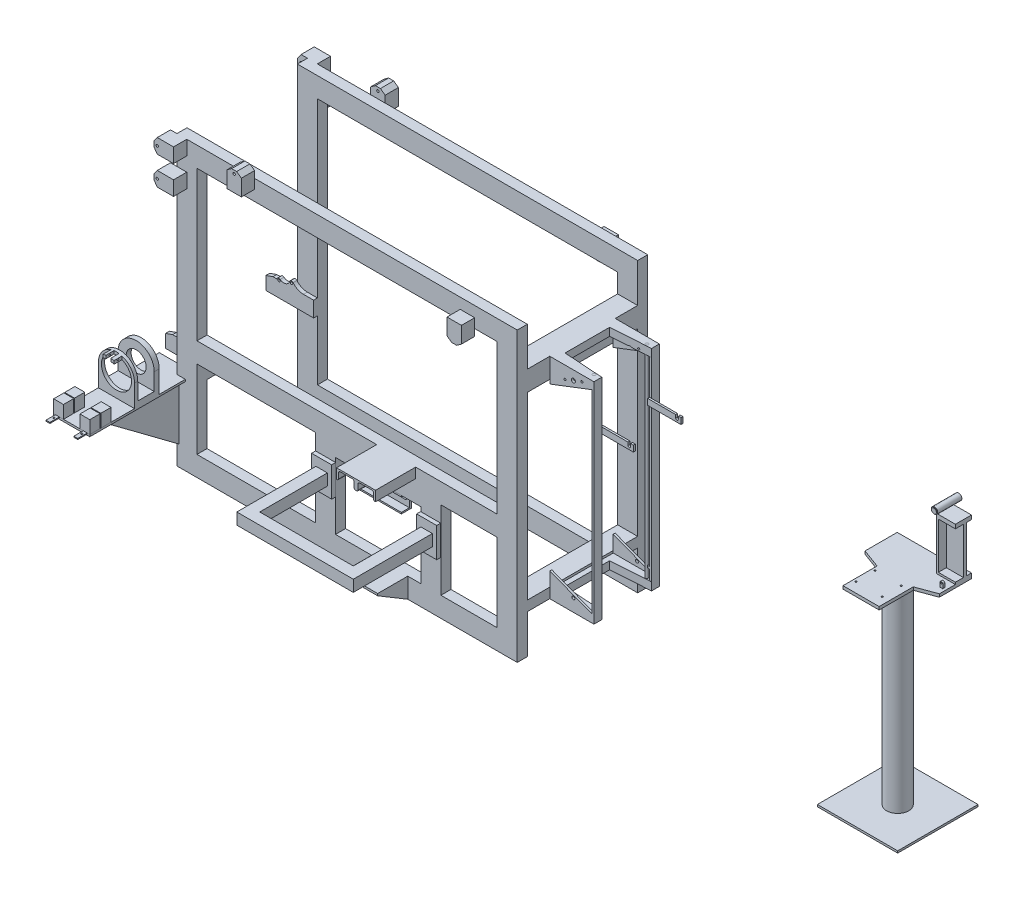
from build123d import *

# Parameters (mm, degrees)
ESQUISSE8_W                    = 1695
ESQUISSE8_H                    = 1434
ESQUISSE8_W_2                  = 1495.38
ESQUISSE8_H_2                  = 744.38
BOSS_EXTRU_8_DEPTH             = 50.13
ESQUISSE9_W                    = 1695
ESQUISSE9_H                    = 1434
ESQUISSE9_W_2                  = 1495.38
ESQUISSE9_H_2                  = 744.38
ESQUISSE9_W_3                  = 280.38
ESQUISSE9_H_3                  = 390.19
ESQUISSE9_W_4                  = 425.38
ESQUISSE9_W_5                  = 590
ESQUISSE9_H_4                  = 58.19
BOSS_EXTRU_9_DEPTH             = 50.13
ESQUISSE12_W                   = 1495.38
ESQUISSE12_H                   = 490
ENL_V_MAT_EXTRU_1_DEPTH        = 50.13
ESQUISSE13_W                   = 650
ESQUISSE13_H                   = 100
ESQUISSE13_H_2                 = 50
BOSS_EXTRU_10_DEPTH            = 99.81
ESQUISSE14_W                   = 39
ESQUISSE14_H                   = 1046
BOSS_EXTRU_11_DEPTH            = 9
BOSS_EXTRU_11_2_DEPTH          = 9
BOSS_EXTRU_12_START            = -162
ESQUISSE15_W                   = 220
ESQUISSE15_H                   = 39
BOSS_EXTRU_12_DEPTH            = 326
BOSS_EXTRU_13_DEPTH            = 10
ENL_V_MAT_EXTRU_2_REACH        = 2374.198
R_P_TITION_LIN_AIRE1_COUNT     = 2
R_P_TITION_LIN_AIRE1_PITCH     = 316
SYM_TRIE1_COPY_1_DEPTH         = 10
BOSS_EXTRU_14_DEPTH            = 66
ESQUISSE20_W                   = 580
ESQUISSE20_H                   = 57
BOSS_EXTRU_15_DEPTH            = 414
ESQUISSE21_W                   = 466
ESQUISSE21_H                   = 357
ENL_V_MAT_EXTRU_3_DEPTH        = 2461.517551857
ESQUISSE22_W                   = 100
ESQUISSE22_H                   = 148
BOSS_EXTRU_16_DEPTH            = 20
BOSS_EXTRU_17_START            = -50.13
ESQUISSE23_W                   = 180
ESQUISSE23_H                   = 10
BOSS_EXTRU_17_DEPTH            = 526.13
ESQUISSE24_W                   = 19.5
ESQUISSE24_H                   = 5
BOSS_EXTRU_18_DEPTH            = 47
BOSS_EXTRU_19_DEPTH            = 10
BOSS_EXTRU_20_DEPTH            = 549.74
ENL_V_MAT_EXTRU_4_REACH        = 2794.265
ESQUISSE27_W                   = 480.87
ESQUISSE27_H                   = 87
ENL_V_MAT_EXTRU_5_DEPTH        = 31
ESQUISSE29_W                   = 49
ESQUISSE29_H                   = 51
BOSS_EXTRU_21_DEPTH            = 64
BOSS_EXTRU_21_2_DEPTH          = 64
BOSS_EXTRU_21_3_DEPTH          = 64
BOSS_EXTRU_21_4_DEPTH          = 64
BOSS_EXTRU_22_DEPTH            = 19
BOSS_EXTRU_23_START            = 130
BOSS_EXTRU_23_DEPTH            = 123
ENL_V_START                    = 25
ESQUISSE33_W                   = 180
ESQUISSE33_H                   = 82
ENL_V_MAT_EXTRU_7_DEPTH        = 2472.330952287
ENL_V_START_2                  = 237
ENL_V_MAT_EXTRU_8_DEPTH        = 2290.876724857
ENL_V_MAT_EXTRU_9_DEPTH        = 2527.876724857
ENL_V_MAT_EXTRU_9_DEPTH_BACK   = 2527.876724857
ESQUISSE34_R                   = 6
ESQUISSE35_W                   = 400
ESQUISSE35_H                   = 400
BOSS_EXTRU_24_DEPTH            = 10
ESQUISSE36_R                   = 55
BOSS_EXTRU_25_DEPTH            = 990
BOSS_EXTRU_27_DEPTH            = 15
BOSS_EXTRU_28_DEPTH            = 200
BOSS_EXTRU_29_START            = -326
ESQUISSE41_W                   = 9
ESQUISSE41_H                   = 30
BOSS_EXTRU_29_DEPTH            = 326
ENL_V_START_3                  = 161
ENL_V_MAT_EXTRU_10_DEPTH       = 328
ENL_V_START_4                  = 201
ENL_V_MAT_EXTRU_10_2_OUTLINE_W = 9
ENL_V_MAT_EXTRU_10_2_OUTLINE_H = 30
ENL_V_MAT_EXTRU_10_2_DEPTH     = 248
ENL_V_START_5                  = 439
ENL_V_MAT_EXTRU_10_3_DEPTH     = 9.402481998
ENL_V_START_6                  = 201.597518002
ENL_V_MAT_EXTRU_10_4_DEPTH     = 9.402481998
ESQUISSE44_W                   = 85
ESQUISSE44_H                   = 20
ESQUISSE44_W_2                 = 10
ESQUISSE44_H_2                 = 10
BOSS_EXTRU_30_DEPTH            = 80
ESQUISSE45_W                   = 15
ESQUISSE45_H                   = 260
BOSS_EXTRU_31_DEPTH            = 85
BOSS_EXTRU_32_START            = -30
ESQUISSE47_R                   = 3
BOSS_EXTRU_32_DEPTH            = 10
ESQUISSE48_R                   = 4
ENL_V_MAT_EXTRU_11_DEPTH       = 20
BOSS_EXTRU_33_START            = -9
ESQUISSE49_R                   = 16
ESQUISSE49_R_2                 = 12.125
BOSS_EXTRU_33_DEPTH            = 120
BOSS_EXTRU_34_START            = -12
ESQUISSE49_3_R                 = 12.125
BOSS_EXTRU_34_DEPTH            = 126
ESQUISSE50_W                   = 15
ESQUISSE50_H                   = 40
BOSS_EXTRU_35_DEPTH            = 200
ENL_V_START_7                  = -40
ENL_V_MAT_EXTRU_12_DEPTH       = 40
ESQUISSE53_R                   = 4
ENL_V_MAT_EXTRU_13_DEPTH       = 70
ESQUISSE54_R                   = 4
ENL_V_MAT_EXTRU_14_DEPTH       = 10
ESQUISSE55_R                   = 7
BOSS_EXTRU_36_DEPTH            = 1046
BOSS_EXTRU_36_2_DEPTH          = 1046
ESQUISSE56_R                   = 5
ESQUISSE56_R_2                 = 10
ESQUISSE56_R_3                 = 7.5
ENL_V_MAT_EXTRU_16_DEPTH       = 3832.536895637
ESQUISSE57_W                   = 12
ESQUISSE57_H                   = 10
BOSS_EXTRU_37_DEPTH            = 39
ESQUISSE58_R                   = 6
BOSS_EXTRU_39_DEPTH            = 18.87
ESQUISSE58_4_R                 = 6
ENL_V_MAT_EXTRU_17_DEPTH       = 18.87
BOSS_EXTRU_40_START            = 480.87
BOSS_EXTRU_40_OUTLINE_R        = 6
BOSS_EXTRU_40_DEPTH            = 19
ENL_V_START_8                  = 499.87
ESQUISSE58_6_R                 = 6
ENL_V_MAT_EXTRU_18_DEPTH       = 19
ENL_V_START_9                  = -20
ENL_V_MAT_EXTRU_19_DEPTH       = 519.87
ESQUISSE60_W                   = 180
ESQUISSE60_H                   = 150
BOSS_EXTRU_41_DEPTH            = 10
BOSS_EXTRU_42_DEPTH            = 10
R_P_TITION_LIN_AIRE2_COUNT     = 2
R_P_TITION_LIN_AIRE2_PITCH     = 170
ESQUISSE62_W                   = 213
ESQUISSE62_H                   = 80
BOSS_EXTRU_43_DEPTH            = 50.13
ESQUISSE63_W                   = 213
ESQUISSE63_H                   = 66
ENL_V_MAT_EXTRU_20_DEPTH       = 40


with BuildPart() as part:
    # Esquisse8 → Boss.-Extru.8 (new body)
    with BuildSketch(Plane.XY):
        with Locations((847.5, 717)):
            Rectangle(ESQUISSE8_W, ESQUISSE8_H)
        with Locations((847.5, 962)):
            Rectangle(ESQUISSE8_W_2, ESQUISSE8_H_2, mode=Mode.SUBTRACT)
    extrude(amount=BOSS_EXTRU_8_DEPTH)

    # Esquisse12 → Enlèv. mat.-Extru.1 (cut)
    with BuildSketch(Plane.XY.offset(50.13)):
        with Locations((847.5, 344.81)):
            Rectangle(ESQUISSE12_W, ESQUISSE12_H)
    extrude(amount=-ENL_V_MAT_EXTRU_1_DEPTH, mode=Mode.SUBTRACT)



with BuildPart() as body_2:
    # Esquisse9 → Boss.-Extru.9 (new body)
    # profile 1 of 2: a face of its own
    with BuildSketch(Plane(origin=(0, 0, 650), x_dir=(-1, 0, 0), z_dir=(0, 0, -1))):
        with Locations((-847.5, 717)):
            Rectangle(ESQUISSE9_W, ESQUISSE9_H)
        with Locations((-847.5, 962)):
            Rectangle(ESQUISSE9_W_2, ESQUISSE9_H_2, mode=Mode.SUBTRACT)
        with Locations((-1455, 294.905)):
            Rectangle(ESQUISSE9_W_3, ESQUISSE9_H_3, mode=Mode.SUBTRACT)
        with Locations((-1002.31, 294.905)):
            Rectangle(ESQUISSE9_W_4, ESQUISSE9_H_3, mode=Mode.SUBTRACT)
        with Locations((-394.81, 294.905)):
            Rectangle(ESQUISSE9_W_5, ESQUISSE9_H_3, mode=Mode.SUBTRACT)
    # profile 2 of 2: a face of its own
    with BuildSketch(Plane(origin=(0, 0, 650), x_dir=(-1, 0, 0), z_dir=(0, 0, -1))):
        with Locations((-1002.31, 460.905)):
            Rectangle(ESQUISSE9_W_4, ESQUISSE9_H_4)
    extrude(amount=BOSS_EXTRU_9_DEPTH)


with BuildPart() as part_1:
    add(part.part)

    add(body_2.part)  # Boss.-Extru.10 merges body 2
    # Esquisse13 → Boss.-Extru.10 (add)
    with BuildSketch(Plane(origin=(1695, 0, 0), x_dir=(0, 0, -1), z_dir=(1, 0, 0))):
        with Locations((-325, 1190)):
            Rectangle(ESQUISSE13_W, ESQUISSE13_H)
        with Locations((-325, 219)):
            Rectangle(ESQUISSE13_W, ESQUISSE13_H_2)
    extrude(amount=-BOSS_EXTRU_10_DEPTH)



with BuildPart() as body_2_2:
    # Esquisse14 → Boss.-Extru.11 (new body)
    with BuildSketch(Plane(origin=(1915, 0, 0), x_dir=(0, 0, -1), z_dir=(1, 0, 0))):
        with Locations((-181.5, 717)):
            Rectangle(ESQUISSE14_W, ESQUISSE14_H)
    extrude(amount=-BOSS_EXTRU_11_DEPTH)


with BuildPart() as body_3:
    # Esquisse14 → Boss.-Extru.11 2 (new body)
    with BuildSketch(Plane(origin=(1915, 0, 0), x_dir=(0, 0, -1), z_dir=(1, 0, 0))):
        with Locations((-468.5, 717)):
            Rectangle(ESQUISSE14_W, ESQUISSE14_H)
    extrude(amount=-BOSS_EXTRU_11_2_DEPTH)


with BuildPart() as part_2:
    add(part_1.part)

    add(body_2_2.part)  # Boss.-Extru.12 merges body 2 2

    add(body_3.part)  # Boss.-Extru.12 merges body 3
    # Esquisse15 → Boss.-Extru.12 (add)
    with BuildSketch(Plane(origin=(0, 0, 0), x_dir=(-1, 0, 0), z_dir=(0, 0, -1)).offset(BOSS_EXTRU_12_START)):
        with Locations((-1805, 1220.5)):
            Rectangle(ESQUISSE15_W, ESQUISSE15_H)
    boss_extru_12 = extrude(amount=-BOSS_EXTRU_12_DEPTH)

    # Esquisse16 → Boss.-Extru.13 (add)
    with BuildSketch(Plane(origin=(0, 0, 162), x_dir=(-1, 0, 0), z_dir=(0, 0, -1))):
        Polygon((-1906, 1201), (-1695, 1120), (-1695, 1201), align=None)
    boss_extru_13 = extrude(amount=-BOSS_EXTRU_13_DEPTH)

    # Esquisse18 → Enlèv. mat.-Extru.2 (cut, up to next)
    with BuildSketch(Plane(origin=(0, 1240, 0), x_dir=(1, 0, 0), z_dir=(0, 1, 0)), mode=Mode.PRIVATE) as enl_v_mat_extru_2_sk1:
        Polygon((1915, -201), (1719.19, -214), (1719.19, -436), (1915, -449), align=None)
    enl_v_mat_extru_2_tool1 = extrude(enl_v_mat_extru_2_sk1.sketch, amount=-ENL_V_MAT_EXTRU_2_REACH, mode=Mode.PRIVATE) & part_2.part
    enl_v_mat_extru_2 = enl_v_mat_extru_2_tool1.solids().sort_by_distance((1818.90034, 1240, 325))[0]
    add(enl_v_mat_extru_2, mode=Mode.SUBTRACT)

    # Répétition linéaire1: Boss.-Extru.13 ×2
    with Locations(*[(0, 0, i * R_P_TITION_LIN_AIRE1_PITCH) for i in range(1, R_P_TITION_LIN_AIRE1_COUNT)]):
        add(boss_extru_13)

    # Symétrie1: Boss.-Extru.12, Boss.-Extru.13, Enlèv. mat.-Extru.2 across plane
    add(boss_extru_12.mirror(Plane.ZX.offset(717)))
    add(boss_extru_13.mirror(Plane.ZX.offset(717)))
    add(enl_v_mat_extru_2.mirror(Plane.ZX.offset(717)), mode=Mode.SUBTRACT)

    # Symétrie1 copy 1 sketch → Symétrie1 copy 1 (add)
    with BuildSketch(Plane(origin=(0, 1434, 478), x_dir=(-1, 0, 0), z_dir=(0, 0, -1))):
        Polygon((-1906, -1201), (-1695, -1120), (-1695, -1201), align=None)
    extrude(amount=-SYM_TRIE1_COPY_1_DEPTH)

    # Esquisse19 → Boss.-Extru.14 (add)
    with BuildSketch(Plane.XY.offset(650)):
        Polygon((49, 1434), (-32, 1434), (-49, 1410.5), (-49, 1385.5), (-32, 1362), (49, 1362), align=None)
        Polygon((49, 1292), (-32, 1292), (-49, 1268.5), (-49, 1243.5), (-32, 1220), (49, 1220), align=None)
        Polygon((315, 1387), (387, 1387), (387, 1468), (363.5, 1484.99999415), (338.5, 1484.99999415), (315, 1468), align=None)
        Polygon((1411, 1381.19), (1483, 1381.19), (1483.000013162, 1300.19), (1459.500006581, 1283.19), (1434.500006581, 1283.19), (1411, 1300.19), align=None)
    boss_extru_14 = extrude(amount=BOSS_EXTRU_14_DEPTH)

    # Symétrie2: Boss.-Extru.14 across plane
    add(boss_extru_14.mirror(Plane(origin=(0, 0, 325), x_dir=(1, 0, 0), z_dir=(0, 0, -1))))

    # Esquisse20 → Boss.-Extru.15 (add)
    with BuildSketch(Plane.XY.offset(650)):
        with Locations((1002.31, 336.31)):
            Rectangle(ESQUISSE20_W, ESQUISSE20_H)
    extrude(amount=BOSS_EXTRU_15_DEPTH)

    # Esquisse21 → Enlèv. mat.-Extru.3 (cut, through all)
    with BuildSketch(Plane(origin=(0, 364.81, 0), x_dir=(1, 0, 0), z_dir=(0, 1, 0))):
        with Locations((1002.31, -828.5)):
            Rectangle(ESQUISSE21_W, ESQUISSE21_H)
    extrude(amount=-ENL_V_MAT_EXTRU_3_DEPTH, mode=Mode.SUBTRACT)

    # Esquisse22 → Boss.-Extru.16 (add)
    with BuildSketch(Plane.XY.offset(650)):
        with Locations((1263.81, 336.31)):
            Rectangle(ESQUISSE22_W, ESQUISSE22_H)
        with Locations((740.81, 336.31)):
            Rectangle(ESQUISSE22_W, ESQUISSE22_H)
    extrude(amount=BOSS_EXTRU_16_DEPTH)

    # Esquisse23 → Boss.-Extru.17 (add)
    with BuildSketch(Plane.XY.offset(650).offset(BOSS_EXTRU_17_START)):
        with Locations((-48.19, 389.81)):
            Rectangle(ESQUISSE23_W, ESQUISSE23_H)
    extrude(amount=BOSS_EXTRU_17_DEPTH)

    # Esquisse24 → Boss.-Extru.18 (add)
    with BuildSketch(Plane.XY.offset(1126)):
        with Locations((19.06, 392.31)):
            Rectangle(ESQUISSE24_W, ESQUISSE24_H)
        with Locations((-119.44, 392.31)):
            Rectangle(ESQUISSE24_W, ESQUISSE24_H)
    extrude(amount=BOSS_EXTRU_18_DEPTH)

    # Esquisse25 → Boss.-Extru.19 (add)
    with BuildSketch(Plane.ZY):
        Polygon((650, 99.81), (1032, 384.81), (650, 384.81), align=None)
    extrude(amount=-BOSS_EXTRU_19_DEPTH)

    # Esquisse26 → Boss.-Extru.20 (add)
    with BuildSketch(Plane(origin=(0, 0, 50.13), x_dir=(-1, 0, 0), z_dir=(0, 0, -1))):
        Polygon((104.248874503, 484.81), (138.19, 472.81), (138.19, 397.81), (-99.81, 397.81), (-99.81, 484.81), align=None)
    extrude(amount=-BOSS_EXTRU_20_DEPTH)

    # Esquisse27 → Enlèv. mat.-Extru.4 (cut, up to next)
    with BuildSketch(Plane.ZY.offset(138.19), mode=Mode.PRIVATE) as enl_v_mat_extru_4_sk1:
        with Locations((309.565, 441.31)):
            Rectangle(ESQUISSE27_W, ESQUISSE27_H)
    enl_v_mat_extru_4_tool1 = extrude(enl_v_mat_extru_4_sk1.sketch, amount=-ENL_V_MAT_EXTRU_4_REACH, mode=Mode.PRIVATE) & part_2.part
    add(enl_v_mat_extru_4_tool1.solids().sort_by_distance((-138.19, 441.31, 309.565))[0], mode=Mode.SUBTRACT)

    # Esquisse28 → Enlèv. mat.-Extru.5 (cut)
    with BuildSketch(Plane.XY.offset(599.87)):
        Polygon((0, 397.81), (0, 484.81), (-104.248874503, 484.81), (-138.19, 472.81), (-138.19, 397.81), align=None)
    extrude(amount=-ENL_V_MAT_EXTRU_5_DEPTH, mode=Mode.SUBTRACT)

    # Esquisse30 → Boss.-Extru.22 (add)
    with BuildSketch(Plane(origin=(0, 0, 599.87), x_dir=(-1, 0, 0), z_dir=(0, 0, -1))):
        Polygon((0, 384.81), (138.19, 384.81), (0, 99.81), align=None)
    extrude(amount=-BOSS_EXTRU_22_DEPTH)

    # Esquisse32 → Boss.-Extru.23 (add)
    with BuildSketch(Plane.XY.offset(650).offset(BOSS_EXTRU_23_START)):
        with BuildLine():
            Line((0, 491.478687236), (0, 447.340669919))
            ThreePointArc((0, 447.340669919), (19.77782327, 473.102351081), (26.81, 504.81))
            Line((26.81, 504.81), (1.81, 504.81))
            ThreePointArc((1.81, 504.81), (1.355433695, 498.083187976), (0, 491.478687236))
        make_face()
        with BuildLine():
            ThreePointArc((-123.19, 504.81), (-79.897648919, 436.84217673), (0, 447.340669919))
            Line((0, 447.340669919), (0, 491.478687236))
            ThreePointArc((0, 491.478687236), (-54.916812024, 455.264566305), (-98.19, 504.81))
            Line((-98.19, 504.81), (-123.19, 504.81))
        make_face()
        with BuildLine():
            ThreePointArc((0, 562.279330081), (-79.897648919, 572.77782327), (-123.19, 504.81))
            Line((-123.19, 504.81), (-98.19, 504.81))
            ThreePointArc((-98.19, 504.81), (-54.916812024, 554.355433695), (0, 518.141312764))
            Line((0, 518.141312764), (0, 562.279330081))
        make_face()
        with BuildLine():
            Line((1.81, 504.81), (26.81, 504.81))
            ThreePointArc((26.81, 504.81), (19.77782327, 536.517648919), (0, 562.279330081))
            Line((0, 562.279330081), (0, 518.141312764))
            ThreePointArc((0, 518.141312764), (1.355433695, 511.536812024), (1.81, 504.81))
        make_face()
        with BuildLine():
            ThreePointArc((0, 580.821340601), (-91.565684433, 583.667783382), (-138.19, 504.81))
            Line((-138.19, 504.81), (-123.19, 504.81))
            ThreePointArc((-123.19, 504.81), (-79.897648919, 572.77782327), (0, 562.279330081))
            Line((0, 562.279330081), (0, 580.821340601))
        make_face()
        with BuildLine():
            ThreePointArc((41.81, 504.81), (30.667783382, 548.185684433), (0, 580.821340601))
            Line((0, 580.821340601), (0, 562.279330081))
            ThreePointArc((0, 562.279330081), (19.77782327, 536.517648919), (26.81, 504.81))
            Line((26.81, 504.81), (41.81, 504.81))
        make_face()
        with BuildLine():
            Line((0, 447.340669919), (0, 394.81))
            Line((0, 394.81), (41.81, 394.81))
            Line((41.81, 394.81), (41.81, 504.81))
            Line((41.81, 504.81), (26.81, 504.81))
            ThreePointArc((26.81, 504.81), (19.77782327, 473.102351081), (0, 447.340669919))
        make_face()
        with BuildLine():
            Line((-138.19, 504.81), (-138.19, 394.81))
            Line((-138.19, 394.81), (0, 394.81))
            Line((0, 394.81), (0, 447.340669919))
            ThreePointArc((0, 447.340669919), (-79.897648919, 436.84217673), (-123.19, 504.81))
            Line((-123.19, 504.81), (-138.19, 504.81))
        make_face()
    extrude(amount=BOSS_EXTRU_23_DEPTH)

    # Esquisse33 → Enlèv. mat.-Extru.7 (cut, through all)
    with BuildSketch(Plane(origin=(0, 394.81, 0), x_dir=(1, 0, 0), z_dir=(0, 1, 0)).offset(ENL_V_START)):
        with Locations((-48.19, -846)):
            Rectangle(ESQUISSE33_W, ESQUISSE33_H)
    extrude(amount=ENL_V_MAT_EXTRU_7_DEPTH, mode=Mode.SUBTRACT)

    # Esquisse32<3> → Enlèv. mat.-Extru.8 (cut, through all)
    with BuildSketch(Plane.XY.offset(650).offset(ENL_V_START_2)):
        with BuildLine():
            Line((0, 491.478687236), (0, 447.340669919))
            ThreePointArc((0, 447.340669919), (19.77782327, 473.102351081), (26.81, 504.81))
            Line((26.81, 504.81), (1.81, 504.81))
            ThreePointArc((1.81, 504.81), (1.355433695, 498.083187976), (0, 491.478687236))
        make_face()
        with BuildLine():
            ThreePointArc((-123.19, 504.81), (-79.897648919, 436.84217673), (0, 447.340669919))
            Line((0, 447.340669919), (0, 491.478687236))
            ThreePointArc((0, 491.478687236), (-54.916812024, 455.264566305), (-98.19, 504.81))
            Line((-98.19, 504.81), (-123.19, 504.81))
        make_face()
        with BuildLine():
            ThreePointArc((0, 562.279330081), (-79.897648919, 572.77782327), (-123.19, 504.81))
            Line((-123.19, 504.81), (-98.19, 504.81))
            ThreePointArc((-98.19, 504.81), (-54.916812024, 554.355433695), (0, 518.141312764))
            Line((0, 518.141312764), (0, 562.279330081))
        make_face()
        with BuildLine():
            Line((1.81, 504.81), (26.81, 504.81))
            ThreePointArc((26.81, 504.81), (19.77782327, 536.517648919), (0, 562.279330081))
            Line((0, 562.279330081), (0, 518.141312764))
            ThreePointArc((0, 518.141312764), (1.355433695, 511.536812024), (1.81, 504.81))
        make_face()
    extrude(amount=ENL_V_MAT_EXTRU_8_DEPTH, mode=Mode.SUBTRACT)

    # Esquisse34 → Enlèv. mat.-Extru.9 (cut, two sides: drawn at the far end of the back side and taken through both)
    with BuildSketch(Plane.XY.offset(650).offset(-ENL_V_MAT_EXTRU_9_DEPTH_BACK)):
        with Locations((-32, 1398)):
            Circle(ESQUISSE34_R)
        with Locations((-32, 1256)):
            Circle(ESQUISSE34_R)
        with Locations((351, 1468)):
            Circle(ESQUISSE34_R)
    extrude(amount=ENL_V_MAT_EXTRU_9_DEPTH + ENL_V_MAT_EXTRU_9_DEPTH_BACK, mode=Mode.SUBTRACT)

    # Esquisse40 → Boss.-Extru.28 (add)
    with BuildSketch(Plane.XY.offset(650)):
        with BuildLine():
            Line((995, 589.81), (1189, 589.81))
            Line((1189, 589.81), (1189, 539.81))
            Line((1189, 539.81), (1187, 539.81))
            ThreePointArc((1187, 539.81), (1181.343145751, 542.153145751), (1179, 547.81))
            Line((1179, 547.81), (1179, 573.81))
            ThreePointArc((1179, 573.81), (1176.656854249, 579.466854249), (1171, 581.81))
            Line((1171, 581.81), (1110, 581.81))
            ThreePointArc((1110, 581.81), (1104.343145751, 579.466854249), (1102, 573.81))
            Line((1102, 573.81), (1102, 547.81))
            ThreePointArc((1102, 547.81), (1099.656854249, 542.153145751), (1094, 539.81))
            Line((1094, 539.81), (1090, 539.81))
            ThreePointArc((1090, 539.81), (1084.343145751, 542.153145751), (1082, 547.81))
            Line((1082, 547.81), (1082, 573.81))
            ThreePointArc((1082, 573.81), (1079.656854249, 579.466854249), (1074, 581.81))
            Line((1074, 581.81), (1013, 581.81))
            ThreePointArc((1013, 581.81), (1007.343145751, 579.466854249), (1005, 573.81))
            Line((1005, 573.81), (1005, 547.81))
            ThreePointArc((1005, 547.81), (1002.656854249, 542.153145751), (997, 539.81))
            Line((997, 539.81), (995, 539.81))
            Line((995, 539.81), (995, 589.81))
        make_face()
    extrude(amount=BOSS_EXTRU_28_DEPTH)

    # Esquisse41 → Boss.-Extru.29 (add)
    with BuildSketch(Plane.XY.offset(488).offset(BOSS_EXTRU_29_START)):
        with BuildLine():
            Line((1915, 1025), (1915, 995))
            Line((1915, 995), (2072, 995))
            Line((2072, 995), (2072, 1025))
            Line((2072, 1025), (2058, 1025))
            Line((2058, 1025), (2058, 1010.5))
            ThreePointArc((2058, 1010.5), (2051.5, 1004), (2045, 1010.5))
            Line((2045, 1010.5), (2045, 1025))
            Line((2045, 1025), (1915, 1025))
        make_face()
        with Locations((1910.5, 1010)):
            Rectangle(ESQUISSE41_W, ESQUISSE41_H)
    extrude(amount=BOSS_EXTRU_29_DEPTH)

    # Enlèv. mat.-Extru.10: read off the stored shape, not the designer's step
    # Enlèv. mat.-Extru.10 outline → Enlèv. mat.-Extru.10 (cut)
    with BuildSketch(Plane.XY.offset(ENL_V_START_3)):
        with BuildLine():
            Line((1915, 1025), (1915, 995))
            Line((1915, 995), (2072, 995))
            Line((2072, 995), (2072, 1025))
            Line((2072, 1025), (2058, 1025))
            Line((2058, 1025), (2058, 1010.5))
            ThreePointArc((2058, 1010.5), (2051.5, 1004), (2045, 1010.5))
            Line((2045, 1010.5), (2045, 1025))
            Line((2045, 1025), (1915, 1025))
        make_face()
    extrude(amount=ENL_V_MAT_EXTRU_10_DEPTH, mode=Mode.SUBTRACT)

    # Enl_v. mat.-Extru.10 2 outline → Enl_v. mat.-Extru.10 2 (cut)
    with BuildSketch(Plane.XY.offset(ENL_V_START_4)):
        with Locations((1910.5, 1010)):
            Rectangle(ENL_V_MAT_EXTRU_10_2_OUTLINE_W, ENL_V_MAT_EXTRU_10_2_OUTLINE_H)
    extrude(amount=ENL_V_MAT_EXTRU_10_2_DEPTH, mode=Mode.SUBTRACT)

    # Esquisse50 → Boss.-Extru.35 (add)
    with BuildSketch(Plane(origin=(0, 394.81, 0), x_dir=(1, 0, 0), z_dir=(0, 1, 0))):
        with Locations((-28.19, -923)):
            Rectangle(ESQUISSE50_W, ESQUISSE50_H)
        with Locations((-68.19, -923)):
            Rectangle(ESQUISSE50_W, ESQUISSE50_H)
    extrude(amount=BOSS_EXTRU_35_DEPTH)

    # Enlèv. mat.-Extru.12: read off the stored shape, not the designer's step
    # Enlèv. mat.-Extru.12 outline → Enlèv. mat.-Extru.12 (cut)
    with BuildSketch(Plane.XY.offset(943).offset(ENL_V_START_7)):
        with BuildLine():
            Line((-75.69, 594.81), (-75.69, 590.505682505))
            ThreePointArc((-75.69, 590.505682505), (-68.263482901, 592.542863194), (-60.69, 593.93771735))
            Line((-60.69, 593.93771735), (-60.69, 594.81))
            Line((-60.69, 594.81), (-75.69, 594.81))
        make_face()
        with BuildLine():
            ThreePointArc((-60.69, 578.760997289), (-68.298623915, 577.06401888), (-75.69, 574.586428685))
            Line((-75.69, 574.586428685), (-75.69, 394.81))
            Line((-75.69, 394.81), (-60.69, 394.81))
            Line((-60.69, 394.81), (-60.69, 578.760997289))
        make_face()
        with BuildLine():
            Line((-35.69, 594.81), (-35.69, 593.93771735))
            ThreePointArc((-35.69, 593.93771735), (-28.116517099, 592.542863194), (-20.69, 590.505682505))
            Line((-20.69, 590.505682505), (-20.69, 594.81))
            Line((-20.69, 594.81), (-35.69, 594.81))
        make_face()
        with BuildLine():
            ThreePointArc((-20.69, 574.586428685), (-28.081376085, 577.06401888), (-35.69, 578.760997289))
            Line((-35.69, 578.760997289), (-35.69, 394.81))
            Line((-35.69, 394.81), (-20.69, 394.81))
            Line((-20.69, 394.81), (-20.69, 574.586428685))
        make_face()
    extrude(amount=ENL_V_MAT_EXTRU_12_DEPTH, mode=Mode.SUBTRACT)

    # Esquisse53 → Enlèv. mat.-Extru.13 (cut)
    with BuildSketch(Plane.ZY.offset(75.69)):
        with Locations((923, 584.586428685)):
            Circle(ESQUISSE53_R)
    extrude(amount=-ENL_V_MAT_EXTRU_13_DEPTH, mode=Mode.SUBTRACT)

    # Esquisse54 → Enlèv. mat.-Extru.14 (cut)
    with BuildSketch(Plane(origin=(0, 394.81, 0), x_dir=(1, 0, 0), z_dir=(0, 1, 0))):
        with Locations(Location((19.06, -1143, 0), (0, 0, 270))):
            Circle(ESQUISSE54_R)
        with Locations(Location((-119.44, -1143, 0), (0, 0, 270))):
            Circle(ESQUISSE54_R)
    extrude(amount=-ENL_V_MAT_EXTRU_14_DEPTH, mode=Mode.SUBTRACT)

    # Esquisse56 → Enlèv. mat.-Extru.16 (cut, through all)
    with BuildSketch(Plane.XY.offset(488)):
        with Locations(Location((1855, 1210, 0), (0, 0, 90))):
            Circle(ESQUISSE56_R)
        with Locations((1770.978386276, 1177.745257291)):
            Circle(ESQUISSE56_R)
        with Locations((1812.989193138, 1193.872628645)):
            Circle(ESQUISSE56_R_2)
        with Locations((1812.989193138, 256.5)):
            Circle(ESQUISSE56_R_3)
    extrude(amount=-ENL_V_MAT_EXTRU_16_DEPTH, mode=Mode.SUBTRACT)

    # Esquisse57 → Boss.-Extru.37 (add)
    with BuildSketch(Plane(origin=(0, 0, 162), x_dir=(-1, 0, 0), z_dir=(0, 0, -1))):
        with Locations((-1900, 289)):
            Rectangle(ESQUISSE57_W, ESQUISSE57_H)
    extrude(amount=-BOSS_EXTRU_37_DEPTH)

    # Esquisse58 → Boss.-Extru.39 (add)
    # profile 1 of 9: a face of its own
    with BuildSketch(Plane(origin=(0, 0, 550), x_dir=(-1, 0, 0), z_dir=(0, 0, -1))):
        with BuildLine():
            ThreePointArc((60.571284677, 489.103192885), (58.391116004, 487.10638466), (56.529128885, 484.81))
            Line((56.529128885, 484.81), (89.376011624, 484.81))
            ThreePointArc((89.376011624, 484.81), (75.900897263, 493.177877017), (60.571284677, 489.103192885))
        make_face()
    # profile 2 of 9: a face of its own
    with BuildSketch(Plane(origin=(0, 0, 550), x_dir=(-1, 0, 0), z_dir=(0, 0, -1))):
        with BuildLine():
            ThreePointArc((60.571284677, 489.103192885), (54.742246092, 485.913755105), (48.19, 484.81))
            Line((48.19, 484.81), (56.529128885, 484.81))
            ThreePointArc((56.529128885, 484.81), (58.391116004, 487.10638466), (60.571284677, 489.103192885))
        make_face()
    # profile 3 of 9: a face of its own
    with BuildSketch(Plane(origin=(0, 0, 550), x_dir=(-1, 0, 0), z_dir=(0, 0, -1))):
        with BuildLine():
            ThreePointArc((29.952570255, 493.066960935), (29.501482848, 488.843216573), (28.168568611, 484.81))
            Line((28.168568611, 484.81), (48.19, 484.81))
            ThreePointArc((48.19, 484.81), (36.303671523, 488.725373945), (29.071285127, 498.938480467))
            ThreePointArc((29.071285127, 498.938480467), (29.731021881, 496.035605621), (29.952570255, 493.066960935))
        make_face()
    # profile 4 of 9: a face of its own
    with BuildSketch(Plane(origin=(0, 0, 550), x_dir=(-1, 0, 0), z_dir=(0, 0, -1))):
        with BuildLine():
            ThreePointArc((-1.599488823, 509.393317879), (-1.172472441, 496.850960203), (2.36424305, 484.81))
            Line((2.36424305, 484.81), (28.168568611, 484.81))
            ThreePointArc((28.168568611, 484.81), (29.501482848, 488.843216573), (29.952570255, 493.066960935))
            ThreePointArc((29.952570255, 493.066960935), (29.731021881, 496.035605621), (29.071285127, 498.938480467))
            ThreePointArc((29.071285127, 498.938480467), (16.405435999, 511.997373601), (-1.599488823, 509.393317879))
        make_face()
        with Locations((9.952570255, 493.066960935)):
            Circle(ESQUISSE58_R, mode=Mode.SUBTRACT)
    # profile 5 of 9: a face of its own
    with BuildSketch(Plane(origin=(0, 0, 550), x_dir=(-1, 0, 0), z_dir=(0, 0, -1))):
        with BuildLine():
            ThreePointArc((-5.560545458, 505.690084197), (-8.864610758, 499.842925717), (-10.046751476, 493.231673708))
            ThreePointArc((-10.046751476, 493.231673708), (-9.613569358, 488.923751956), (-8.263428102, 484.81))
            Line((-8.263428102, 484.81), (2.36424305, 484.81))
            ThreePointArc((2.36424305, 484.81), (-1.172472441, 496.850960203), (-1.599488823, 509.393317879))
            ThreePointArc((-1.599488823, 509.393317879), (-3.706104883, 507.67656714), (-5.560545458, 505.690084197))
        make_face()
    # profile 6 of 9: a face of its own
    with BuildSketch(Plane(origin=(0, 0, 550), x_dir=(-1, 0, 0), z_dir=(0, 0, -1))):
        with BuildLine():
            Line((2.36424305, 484.81), (-8.263428102, 484.81))
            ThreePointArc((-8.263428102, 484.81), (-1.050329395, 476.365577779), (9.555432537, 473.070904283))
            ThreePointArc((9.555432537, 473.070904283), (5.553886293, 478.691772496), (2.36424305, 484.81))
        make_face()
    # profile 7 of 9: a face of its own
    with BuildSketch(Plane(origin=(0, 0, 550), x_dir=(-1, 0, 0), z_dir=(0, 0, -1))):
        with BuildLine():
            ThreePointArc((2.36424305, 484.81), (5.553886293, 478.691772496), (9.555432537, 473.070904283))
            ThreePointArc((9.555432537, 473.070904283), (20.621663032, 476.150387425), (28.168568611, 484.81))
            Line((28.168568611, 484.81), (2.36424305, 484.81))
        make_face()
    # profile 8 of 9: a face of its own
    with BuildSketch(Plane(origin=(0, 0, 550), x_dir=(-1, 0, 0), z_dir=(0, 0, -1))):
        with BuildLine():
            ThreePointArc((-10.046751476, 493.231673708), (-10.554606265, 488.915012088), (-11.983017895, 484.81))
            Line((-11.983017895, 484.81), (-8.263428102, 484.81))
            ThreePointArc((-8.263428102, 484.81), (-9.613569358, 488.923751956), (-10.046751476, 493.231673708))
        make_face()
    # profile 9 of 9: a face of its own
    with BuildSketch(Plane(origin=(0, 0, 550), x_dir=(-1, 0, 0), z_dir=(0, 0, -1))):
        with BuildLine():
            Line((-49.470071636, 484.81), (-11.983017895, 484.81))
            ThreePointArc((-11.983017895, 484.81), (-10.554606265, 488.915012088), (-10.046751476, 493.231673708))
            ThreePointArc((-10.046751476, 493.231673708), (-8.864610758, 499.842925717), (-5.560545458, 505.690084197))
            ThreePointArc((-5.560545458, 505.690084197), (-25.159454586, 490.295826868), (-49.470071636, 484.81))
        make_face()
    extrude(amount=-BOSS_EXTRU_39_DEPTH)

    # Esquisse58<4> → Enlèv. mat.-Extru.17 (cut)
    with BuildSketch(Plane(origin=(0, 0, 550), x_dir=(-1, 0, 0), z_dir=(0, 0, -1))):
        with Locations((72.952570255, 473.39638648)):
            Circle(ESQUISSE58_4_R)
    extrude(amount=-ENL_V_MAT_EXTRU_17_DEPTH, mode=Mode.SUBTRACT)

    # Boss.-Extru.40: read off the stored shape, not the designer's step
    # Boss.-Extru.40 outline → Boss.-Extru.40 (add)
    # profile 1 of 2: a face of its own
    with BuildSketch(Plane(origin=(0, 0, 550), x_dir=(-1, 0, 0), z_dir=(0, 0, -1)).offset(BOSS_EXTRU_40_START)):
        with BuildLine():
            Line((-49.470071636, 484.81), (48.19, 484.81))
            ThreePointArc((48.19, 484.81), (36.303671523, 488.725373945), (29.071285127, 498.938480467))
            ThreePointArc((29.071285127, 498.938480467), (13.779595804, 512.697393315), (-5.560545458, 505.690084197))
            ThreePointArc((-5.560545458, 505.690084197), (-25.159454587, 490.295826868), (-49.470071636, 484.81))
        make_face()
        with Locations((9.952570255, 493.066960935)):
            Circle(BOSS_EXTRU_40_OUTLINE_R, mode=Mode.SUBTRACT)
    # profile 2 of 2: a face of its own
    with BuildSketch(Plane(origin=(0, 0, 550), x_dir=(-1, 0, 0), z_dir=(0, 0, -1)).offset(BOSS_EXTRU_40_START)):
        with BuildLine():
            ThreePointArc((89.376011624, 484.81), (75.900897546, 493.177876975), (60.571285127, 489.10319324))
            ThreePointArc((60.571285127, 489.10319324), (54.742246363, 485.913755199), (48.19, 484.81))
            Line((48.19, 484.81), (89.376011624, 484.81))
        make_face()
    extrude(amount=BOSS_EXTRU_40_DEPTH)

    # Esquisse58<6> → Enlèv. mat.-Extru.18 (cut)
    with BuildSketch(Plane(origin=(0, 0, 550), x_dir=(-1, 0, 0), z_dir=(0, 0, -1)).offset(ENL_V_START_8)):
        with Locations((72.952570255, 473.39638648)):
            Circle(ESQUISSE58_6_R)
    extrude(amount=-ENL_V_MAT_EXTRU_18_DEPTH, mode=Mode.SUBTRACT)

    # Esquisse59 → Enlèv. mat.-Extru.19 (cut)
    with BuildSketch(Plane(origin=(0, 0, 550), x_dir=(-1, 0, 0), z_dir=(0, 0, -1)).offset(ENL_V_START_9)):
        with BuildLine():
            Line((-49.470071636, 484.81), (-99.81, 484.81))
            Line((-99.81, 484.81), (-99.81, 474.81))
            Line((-99.81, 474.81), (-49.470071636, 474.81))
            ThreePointArc((-49.470071636, 474.81), (-20.865017272, 481.264890696), (2.196012399, 499.378522566))
            ThreePointArc((2.196012399, 499.378522566), (11.86608303, 502.882177125), (19.511927691, 496.002720701))
            ThreePointArc((19.511927691, 496.002720701), (39.24875949, 476.173411199), (66.761927691, 481.24978986))
            ThreePointArc((66.761927691, 481.24978986), (76.668317659, 482.680416921), (82.852150893, 474.81))
            Line((82.852150893, 474.81), (102.533145751, 474.81))
            Line((102.533145751, 474.81), (138.19, 462.203398282))
            Line((138.19, 462.203398282), (138.19, 472.81))
            Line((138.19, 472.81), (104.248874503, 484.81))
            Line((104.248874503, 484.81), (89.376011624, 484.81))
            ThreePointArc((89.376011624, 484.81), (75.900897547, 493.177876975), (60.571285127, 489.10319324))
            ThreePointArc((60.571285127, 489.10319324), (42.229172993, 485.7189408), (29.071285127, 498.938480467))
            ThreePointArc((29.071285127, 498.938480467), (13.779595804, 512.697393315), (-5.560545458, 505.690084197))
            ThreePointArc((-5.560545458, 505.690084197), (-25.159454586, 490.295826868), (-49.470071636, 484.81))
        make_face()
    extrude(amount=ENL_V_MAT_EXTRU_19_DEPTH, mode=Mode.SUBTRACT)

    # Esquisse60 → Boss.-Extru.41 (add)
    with BuildSketch(Plane(origin=(0, 99.81, 0), x_dir=(1, 0, 0), z_dir=(0, 1, 0))):
        with Locations((1059.81, -725)):
            Rectangle(ESQUISSE60_W, ESQUISSE60_H)
    extrude(amount=-BOSS_EXTRU_41_DEPTH)

    # Esquisse61 → Boss.-Extru.42 (add)
    with BuildSketch(Plane.ZY.offset(-969.81)):
        Polygon((800, 89.81), (650, 0), (650, 89.81), align=None)
    boss_extru_42 = extrude(amount=-BOSS_EXTRU_42_DEPTH)

    # Répétition linéaire2: Boss.-Extru.42 ×2
    with Locations(*[(i * R_P_TITION_LIN_AIRE2_PITCH, 0, 0) for i in range(1, R_P_TITION_LIN_AIRE2_COUNT)]):
        add(boss_extru_42)


with BuildPart() as body_2_3:
    # Esquisse29 → Boss.-Extru.21 (new body)
    with BuildSketch(Plane(origin=(0, 394.81, 0), x_dir=(1, 0, 0), z_dir=(0, 1, 0))):
        with Locations((-113.69, -1100.5)):
            Rectangle(ESQUISSE29_W, ESQUISSE29_H)
    extrude(amount=BOSS_EXTRU_21_DEPTH)


with BuildPart() as body_3_2:
    # Esquisse29 → Boss.-Extru.21 2 (new body)
    with BuildSketch(Plane(origin=(0, 394.81, 0), x_dir=(1, 0, 0), z_dir=(0, 1, 0))):
        with Locations((17.31, -1100.5)):
            Rectangle(ESQUISSE29_W, ESQUISSE29_H)
    extrude(amount=BOSS_EXTRU_21_2_DEPTH)


with BuildPart() as body_4:
    # Esquisse29 → Boss.-Extru.21 3 (new body)
    with BuildSketch(Plane(origin=(0, 394.81, 0), x_dir=(1, 0, 0), z_dir=(0, 1, 0))):
        with Locations((17.31, -1045.5)):
            Rectangle(ESQUISSE29_W, ESQUISSE29_H)
    extrude(amount=BOSS_EXTRU_21_3_DEPTH)


with BuildPart() as body_5:
    # Esquisse29 → Boss.-Extru.21 4 (new body)
    with BuildSketch(Plane(origin=(0, 394.81, 0), x_dir=(1, 0, 0), z_dir=(0, 1, 0))):
        with Locations((-113.69, -1045.5)):
            Rectangle(ESQUISSE29_W, ESQUISSE29_H)
    extrude(amount=BOSS_EXTRU_21_4_DEPTH)


with BuildPart() as body_6:
    # Esquisse35 → Boss.-Extru.24 (new body)
    with BuildSketch(Plane.XZ):
        with Locations((3265, 325)):
            Rectangle(ESQUISSE35_W, ESQUISSE35_H)
    extrude(amount=-BOSS_EXTRU_24_DEPTH)

    # Esquisse36 → Boss.-Extru.25 (add)
    with BuildSketch(Plane(origin=(0, 10, 0), x_dir=(1, 0, 0), z_dir=(0, 1, 0))):
        with Locations(Location((3265, -325, 0), (0, 0, 270))):
            Circle(ESQUISSE36_R)
    extrude(amount=BOSS_EXTRU_25_DEPTH)

    # Esquisse38 → Boss.-Extru.27 (add)
    with BuildSketch(Plane(origin=(0, 1000, 0), x_dir=(1, 0, 0), z_dir=(0, 1, 0))):
        Polygon((3355, -337.5), (3355, -507.5), (3175, -507.5), (3175, -337.5), (3080, -302.5), (3080, -142.5), (3450, -142.5), (3450, -302.5), align=None)
    extrude(amount=-BOSS_EXTRU_27_DEPTH)

    # Esquisse44 → Boss.-Extru.30 (add)
    with BuildSketch(Plane(origin=(0, 0, 142.5), x_dir=(-1, 0, 0), z_dir=(0, 0, -1))):
        with Locations((-3407.5, 1250)):
            Rectangle(ESQUISSE44_W, ESQUISSE44_H)
        with Locations((-3360, 1250)):
            Rectangle(ESQUISSE44_W_2, ESQUISSE44_H)
        Polygon((-3355, 1240), (-3365, 1240), (-3365, 1010), (-3365, 1000), (-3355, 1000), align=None)
        with Locations((-3407.5, 1005)):
            Rectangle(ESQUISSE44_W, ESQUISSE44_H_2)
    extrude(amount=-BOSS_EXTRU_30_DEPTH)

    # Esquisse45 → Boss.-Extru.31 (add)
    with BuildSketch(Plane(origin=(3450, 0, 0), x_dir=(0, 0, -1), z_dir=(1, 0, 0))):
        with Locations((-175, 1130)):
            Rectangle(ESQUISSE45_W, ESQUISSE45_H)
    extrude(amount=-BOSS_EXTRU_31_DEPTH)

    # Esquisse47 → Boss.-Extru.32 (add)
    with BuildSketch(Plane.XY.offset(302.5).offset(BOSS_EXTRU_32_START)):
        with BuildLine():
            Line((3422, 1000), (3437, 1000))
            Line((3437, 1000), (3437, 1020))
            ThreePointArc((3437, 1020), (3429.5, 1027.5), (3422, 1020))
            Line((3422, 1020), (3422, 1000))
        make_face()
        with Locations(Location((3429.5, 1020, 0), (0, 0, 180))):
            Circle(ESQUISSE47_R, mode=Mode.SUBTRACT)
    extrude(amount=-BOSS_EXTRU_32_DEPTH)

    # Esquisse48 → Enlèv. mat.-Extru.11 (cut)
    with BuildSketch(Plane(origin=(0, 1000, 0), x_dir=(1, 0, 0), z_dir=(0, 1, 0))):
        with Locations(Location((3320, -457.5, 0), (0, 0, 270))):
            Circle(ESQUISSE48_R)
        with Locations(Location((3190, -457.5, 0), (0, 0, 270))):
            Circle(ESQUISSE48_R)
        with Locations(Location((3190, -362.5, 0), (0, 0, 270))):
            Circle(ESQUISSE48_R)
        with Locations(Location((3320, -362.5, 0), (0, 0, 270))):
            Circle(ESQUISSE48_R)
    extrude(amount=-ENL_V_MAT_EXTRU_11_DEPTH, mode=Mode.SUBTRACT)


with BuildPart() as body_7:
    # Enl_v. mat.-Extru.10 3 outline → Enl_v. mat.-Extru.10 3 (new body)
    with BuildSketch(Plane.XY.offset(ENL_V_START_5)):
        with BuildLine():
            Line((2072, 1025), (2058, 1025))
            Line((2058, 1025), (2058, 1010.5))
            ThreePointArc((2058, 1010.5), (2051.5, 1004), (2045, 1010.5))
            Line((2045, 1010.5), (2045, 1025))
            Line((2045, 1025), (1906, 1025))
            Line((1906, 1025), (1906, 995))
            Line((1906, 995), (2072, 995))
            Line((2072, 995), (2072, 1025))
        make_face()
    extrude(amount=ENL_V_MAT_EXTRU_10_3_DEPTH)


with BuildPart() as body_8:
    # Enl_v. mat.-Extru.10 4 outline → Enl_v. mat.-Extru.10 4 (new body)
    with BuildSketch(Plane.XY.offset(ENL_V_START_6)):
        with BuildLine():
            Line((2072, 1025), (2058, 1025))
            Line((2058, 1025), (2058, 1010.5))
            ThreePointArc((2058, 1010.5), (2051.5, 1004), (2045, 1010.5))
            Line((2045, 1010.5), (2045, 1025))
            Line((2045, 1025), (1906, 1025))
            Line((1906, 1025), (1906, 995))
            Line((1906, 995), (2072, 995))
            Line((2072, 995), (2072, 1025))
        make_face()
    extrude(amount=ENL_V_MAT_EXTRU_10_4_DEPTH)


with BuildPart() as body_9:
    # Esquisse49 → Boss.-Extru.33 (new body)
    with BuildSketch(Plane(origin=(0, 0, 222.5), x_dir=(-1, 0, 0), z_dir=(0, 0, -1)).offset(BOSS_EXTRU_33_START)):
        with Locations((-3355, 1276)):
            Circle(ESQUISSE49_R)
        with Locations((-3355, 1276)):
            Circle(ESQUISSE49_R_2, mode=Mode.SUBTRACT)
    extrude(amount=BOSS_EXTRU_33_DEPTH)

    # Esquisse49<3> → Boss.-Extru.34 (add)
    with BuildSketch(Plane(origin=(0, 0, 222.5), x_dir=(-1, 0, 0), z_dir=(0, 0, -1)).offset(BOSS_EXTRU_34_START)):
        with Locations(Location((-3355, 1276, 0), (0, 0, 180))):
            Circle(ESQUISSE49_3_R)
    extrude(amount=BOSS_EXTRU_34_DEPTH)


with BuildPart() as body_10:
    # Esquisse55 → Boss.-Extru.36 (new body)
    with BuildSketch(Plane(origin=(0, 1240, 0), x_dir=(1, 0, 0), z_dir=(0, 1, 0))):
        with Locations(Location((1884, -193.036103044, 0), (0, 0, 270))):
            Circle(ESQUISSE55_R)
    extrude(amount=-BOSS_EXTRU_36_DEPTH)


with BuildPart() as body_11:
    # Esquisse55 → Boss.-Extru.36 2 (new body)
    with BuildSketch(Plane(origin=(0, 1240, 0), x_dir=(1, 0, 0), z_dir=(0, 1, 0))):
        with Locations(Location((1884, -456.963896956, 0), (0, 0, 90))):
            Circle(ESQUISSE55_R)
    extrude(amount=-BOSS_EXTRU_36_2_DEPTH)


with BuildPart() as body_12:
    # Esquisse62 → Boss.-Extru.43 (new body)
    with BuildSketch(Plane.XY.offset(650)):
        with Locations((1011.31, 391.81)):
            Rectangle(ESQUISSE62_W, ESQUISSE62_H)
        with BuildLine():
            Line((962.81, 398.81), (1096.81, 398.81))
            ThreePointArc((1096.81, 398.81), (1103.81, 391.81), (1096.81, 384.81))
            Line((1096.81, 384.81), (962.81, 384.81))
            ThreePointArc((962.81, 384.81), (955.81, 391.81), (962.81, 398.81))
        make_face(mode=Mode.SUBTRACT)
    extrude(amount=-BOSS_EXTRU_43_DEPTH)

    # Esquisse63 → Enlèv. mat.-Extru.20 (cut)
    with BuildSketch(Plane.XY.offset(650)):
        with Locations((1011.31, 391.81)):
            Rectangle(ESQUISSE63_W, ESQUISSE63_H)
        with BuildLine():
            Line((1096.81, 384.81), (962.81, 384.81))
            ThreePointArc((962.81, 384.81), (955.81, 391.81), (962.81, 398.81))
            Line((962.81, 398.81), (1096.81, 398.81))
            ThreePointArc((1096.81, 398.81), (1103.81, 391.81), (1096.81, 384.81))
        make_face(mode=Mode.SUBTRACT)
    extrude(amount=-ENL_V_MAT_EXTRU_20_DEPTH, mode=Mode.SUBTRACT)


solid = Compound([part_2.part, body_2_3.part, body_3_2.part, body_4.part, body_5.part, body_6.part, body_7.part, body_8.part, body_9.part, body_10.part, body_11.part, body_12.part])
